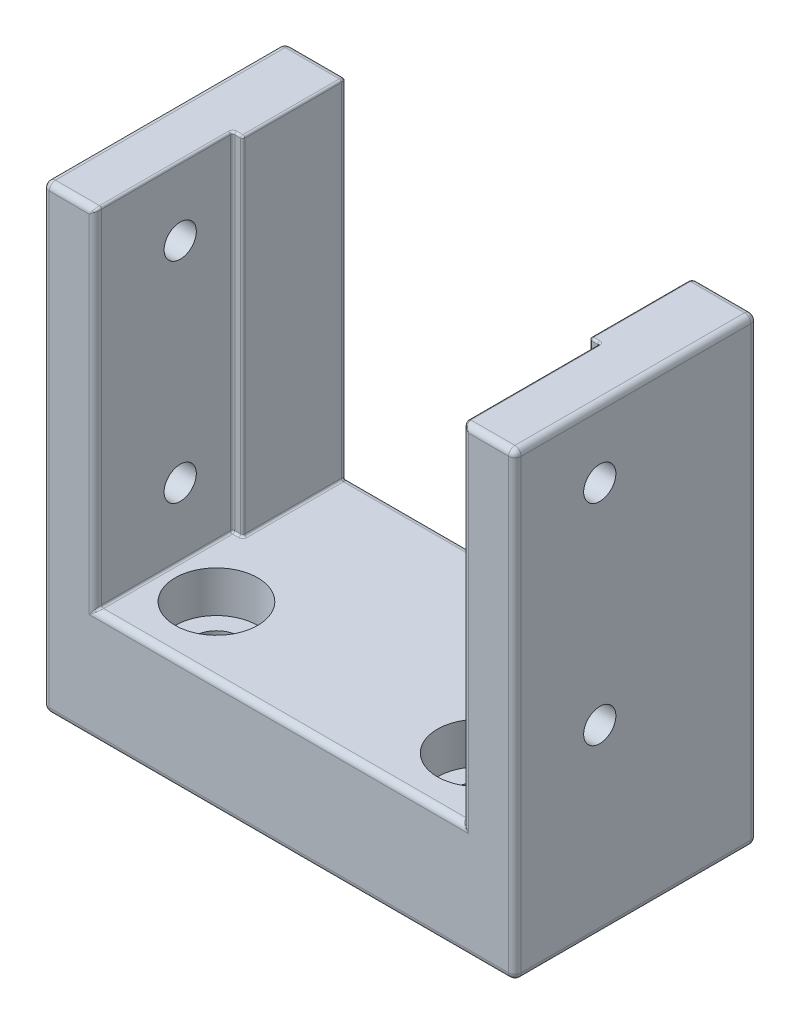
from build123d import *

# Parameters (mm, degrees)
SKETCH1_W                      = 44.45
SKETCH1_H                      = 29.3250112
BOSS_EXTRUDE1_DEPTH            = 13.685012
SKETCH2_W                      = 29.3250112
SKETCH2_H                      = 55.6850042
BOSS_EXTRUDE2_DEPTH            = 6.35
M3_5_CLEARANCE_HOLE1_D         = 3.9
SKETCH8_W                      = 12.7
SKETCH8_H                      = 41.9999922
BOSS_EXTRUDE6_DEPTH            = 1.2249912
CBORE_FOR_M5_SHCS1_D           = 5.5
CBORE_FOR_M5_SHCS1_CBORE_D     = 10
CBORE_FOR_M5_SHCS1_CBORE_DEPTH = 5
FILLET1_R                      = 0.762
FILLET2_R                      = 0.254


with BuildPart() as part:
    # Sketch1 → Boss-Extrude1 (new body)
    with BuildSketch(Plane(origin=(0, 0, 0), x_dir=(1, 0, 0), z_dir=(0, 1, 0))):
        Rectangle(SKETCH1_W, SKETCH1_H)
    extrude(amount=-BOSS_EXTRUDE1_DEPTH)

    # Sketch2 → Boss-Extrude2 (add)
    with BuildSketch(Plane(origin=(22.225, 0, 0), x_dir=(0, 0, -1), z_dir=(1, 0, 0))):
        with Locations((0, 14.1574901)):
            Rectangle(SKETCH2_W, SKETCH2_H)
    boss_extrude2 = extrude(amount=BOSS_EXTRUDE2_DEPTH)

    # M3.5 Clearance Hole1 (through all)
    with Locations(Plane(origin=(28.575, 0, 0), x_dir=(0, 0, -1), z_dir=(1, 0, 0))):
        with Locations((-4.3874944, 33.7), (-4.3874944, 8.3)):
            m3_5_clearance_hole1 = Hole(M3_5_CLEARANCE_HOLE1_D / 2)

    # Mirror1: Boss-Extrude2, M3.5 Clearance Hole1 across plane
    add(boss_extrude2.mirror(Plane(origin=(0, 0, 0), x_dir=(0, 0, 1), z_dir=(1, 0, 0))))
    add(m3_5_clearance_hole1.mirror(Plane(origin=(0, 0, 0), x_dir=(0, 0, 1), z_dir=(1, 0, 0))), mode=Mode.SUBTRACT)

    # Sketch8 → Boss-Extrude6 (add)
    with BuildSketch(Plane.ZY.offset(-22.225)):
        with Locations((-8.3125056, 20.9999961)):
            Rectangle(SKETCH8_W, SKETCH8_H)
    boss_extrude6 = extrude(amount=BOSS_EXTRUDE6_DEPTH)

    # Mirror2: Boss-Extrude6 across plane
    add(boss_extrude6.mirror(Plane(origin=(0, 0, 0), x_dir=(0, 0, 1), z_dir=(1, 0, 0))))

    # CBORE for M5 SHCS1 (through all)
    with Locations(Plane(origin=(0, 0, 0), x_dir=(1, 0, 0), z_dir=(0, 1, 0))):
        with Locations((15.875, -6.35), (-15.875, -6.35)):
            CounterBoreHole(CBORE_FOR_M5_SHCS1_D / 2, CBORE_FOR_M5_SHCS1_CBORE_D / 2, CBORE_FOR_M5_SHCS1_CBORE_DEPTH)

    # Fillet1
    fillet1_edges = [part.edges().sort_by_distance(p)[0] for p in [
        (-21.0000088, 20.9999961, -14.6625056),
        (-24.7875044, 41.9999922, -14.6625056),
        (-28.575, 14.1574901, -14.6625056),
        (28.575, 14.1574901, -14.6625056),
        (24.7875044, 41.9999922, -14.6625056),
        (21.0000088, 20.9999961, -14.6625056),
        (0, 0, -14.6625056),
        (22.225, 20.9999961, 14.6625056),
        (25.4, 41.9999922, 14.6625056),
        (28.575, 14.1574901, 14.6625056),
        (-28.575, 14.1574901, 14.6625056),
        (-25.4, 41.9999922, 14.6625056),
        (-22.225, 20.9999961, 14.6625056),
        (0, 0, 14.6625056),
        (28.575, -13.685012, 0),
        (0, -13.685012, -14.6625056),
        (-28.575, -13.685012, 0),
        (0, -13.685012, 14.6625056),
        (-13.125, -13.685012, 6.35),
        (18.625, -13.685012, 6.35),
        (28.575, 41.9999922, 0),
        (-28.575, 41.9999922, 0),
    ]]
    fillet(fillet1_edges, radius=FILLET1_R)

    # Fillet2
    fillet2_edges = [part.edges().sort_by_distance(p)[0] for p in [
        (-21.269719533, -0.269710733, -14.482137165),
        (21.269719533, -0.269710733, -14.482137165),
        (22.494710733, 41.730281467, 14.482137165),
        (-21.0000088, 0, -7.9315056),
        (21.0000088, 0, -7.9315056),
        (22.225, 41.9999922, 5.969),
        (-22.494710733, -0.269710733, 14.482137165),
        (-21.269719533, 41.730281467, -14.482137165),
        (-22.494710733, 41.730281467, 14.482137165),
        (22.494710733, -0.269710733, 14.482137165),
        (21.269719533, 41.730281467, -14.482137165),
        (-22.225, 0, 5.969),
        (-21.6125044, 0, -1.9625056),
        (-21.0000088, 41.9999922, -7.9315056),
        (-21.0000088, 20.9999961, -1.9625056),
        (-22.225, 20.9999961, -1.9625056),
        (-21.6125044, 41.9999922, -1.9625056),
        (-22.225, 41.9999922, 5.969),
        (21.6125044, 0, -1.9625056),
        (22.225, 0, 5.969),
        (21.6125044, 41.9999922, -1.9625056),
        (21.0000088, 20.9999961, -1.9625056),
        (22.225, 20.9999961, -1.9625056),
        (21.0000088, 41.9999922, -7.9315056),
    ]]
    fillet(fillet2_edges, radius=FILLET2_R)


solid = part.part
